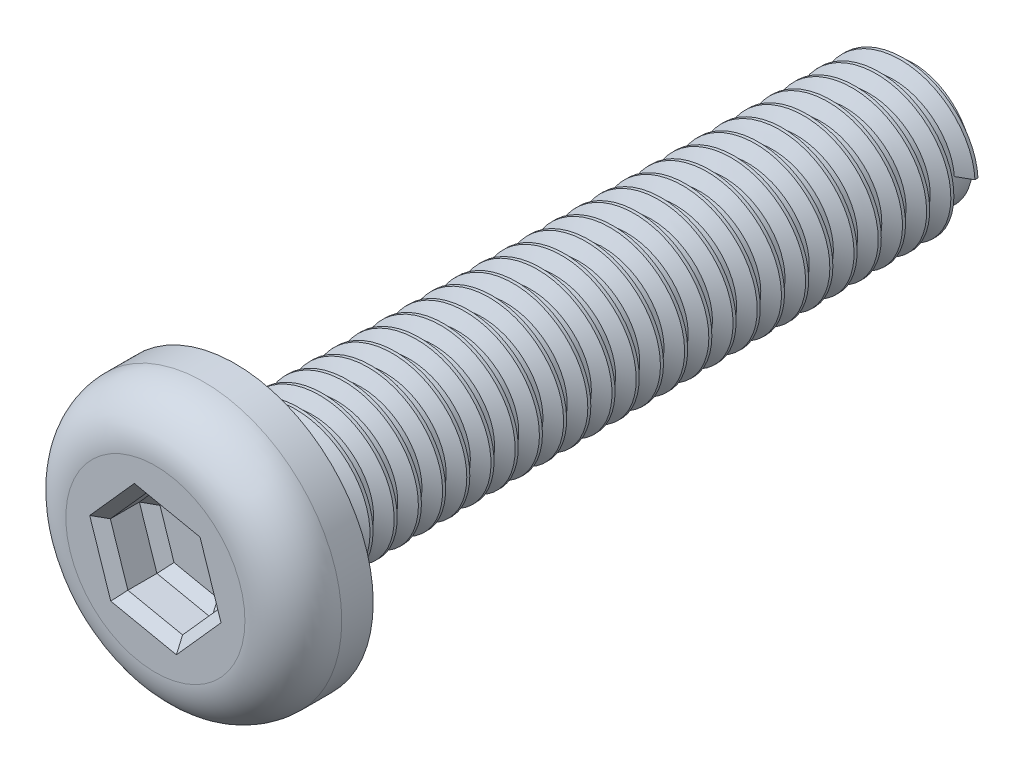
from build123d import *

# Parameters (mm, degrees)
SKETCH_1_R          = 2.85
EXTRUDE_1_DEPTH     = 1.65
SKETCH_2_R          = 1.2295
EXTRUDE_2_DEPTH     = 14
FILLET_1_R          = 1
CUT_EXTRUDE_1_DEPTH = 1
CHAMFER_1_SIZE      = 0.2
THREAD_1_PITCH      = 0.5


with BuildPart() as part:
    # 草图1 → 凸台-拉伸1 (new body)
    with BuildSketch(Plane.XY):
        Circle(SKETCH_1_R)
    extrude(amount=EXTRUDE_1_DEPTH)

    # Sketch 2 → 凸台-拉伸2 (add)
    with BuildSketch(Plane(origin=(0, 0, 0), x_dir=(-1, 0, 0), z_dir=(0, 0, -1))):
        Circle(SKETCH_2_R)
    extrude(amount=EXTRUDE_2_DEPTH)

    # 圆角1
    fillet_1_edges = [part.edges().sort_by_distance(p)[0] for p in [
        (-2.85, 0, 1.65),
    ]]
    fillet(fillet_1_edges, radius=FILLET_1_R)

    # 草图3 → 切除-拉伸1 (cut)
    with BuildSketch(Plane.XY.offset(1.65)):
        Polygon((0.362222341, -1.09641612), (1.130635384, -0.234514311), (0.768413043, 0.861901809), (-0.362222341, 1.09641612), (-1.130635384, 0.234514311), (-0.768413043, -0.861901809), align=None)
    extrude(amount=-CUT_EXTRUDE_1_DEPTH, mode=Mode.SUBTRACT)

    # 倒角1
    chamfer_1_edges = [part.edges().sort_by_distance(p)[0] for p in [
        (-0.203095351, -0.979158965, 0.65),
        (-0.949524213, -0.313693749, 0.65),
        (-0.746428862, 0.665465216, 0.65),
        (0.203095351, 0.979158965, 0.65),
        (0.949524213, 0.313693749, 0.65),
        (0.746428862, -0.665465216, 0.65),
        (-0.203095351, -0.979158965, 1.65),
        (0.746428862, -0.665465216, 1.65),
        (0.949524213, 0.313693749, 1.65),
        (0.203095351, 0.979158965, 1.65),
        (-0.746428862, 0.665465216, 1.65),
        (-0.949524213, -0.313693749, 1.65),
    ]]
    chamfer(chamfer_1_edges, length=CHAMFER_1_SIZE)

    # 螺纹线1: the profile of Sketch 2 2 profile screwed along a right-hand helix of 28 turns, 6 arcs to a turn; built about Z, then put on its axis
    thread_1_z = Axis((0, 0, 0), (0, 0, 1))
    thread_1_corners = [(1.2292, 0, -0.000173205), (1.500132938, 0, 0.156249999), (1.500132938, 0, 0.218749999), (1.2292, 0, 0.375173204)]
    with BuildLine(mode=Mode.PRIVATE) as thread_1_profile:
        Line(thread_1_corners[0], thread_1_corners[1])
        Line(thread_1_corners[1], thread_1_corners[2])
        Line(thread_1_corners[2], thread_1_corners[3])
        Line(thread_1_corners[3], thread_1_corners[0])
    thread_1_cap = Face(thread_1_profile.wire())
    thread_1_turn_angles = [0, 30, 60, 90, 120, 150, 180, 210, 240, 270, 300, 330, 360]
    thread_1_turn_weights = [1, 0.8660254037844387, 1, 0.8660254037844387, 1, 0.8660254037844387, 1, 0.8660254037844387, 1, 0.8660254037844387, 1, 0.8660254037844387, 1]
    thread_1_turn_rails = [Edge.make_bspline([Vector(p[0], p[1], 0).rotate(thread_1_z, thread_1_turn_angles[k]) / thread_1_turn_weights[k] + Vector(0, 0, p[2] + THREAD_1_PITCH * thread_1_turn_angles[k] / 360) for k in range(13)], [0, 0, 0, 1, 1, 2, 2, 3, 3, 4, 4, 5, 5, 6, 6, 6], 2, thread_1_turn_weights) for p in thread_1_corners]
    thread_1_turn_sides = [Face.make_surface_from_curves(thread_1_turn_rails[p[0]], thread_1_turn_rails[p[1]]) for p in [(0, 1), (1, 2), (2, 3), (3, 0)]]
    thread_1 = Plane(origin=(0, 0, -14), x_dir=(1, 0, 0), z_dir=(0, 0, 1)) * Solid(Shell([*[p.moved(Location((0, 0, THREAD_1_PITCH * i))) for i in range(28) for p in thread_1_turn_sides], thread_1_cap, thread_1_cap.rotate(thread_1_z, 10080).moved(Location((0, 0, THREAD_1_PITCH * 10080 / 360)))]))
    add(thread_1)


solid = part.part
